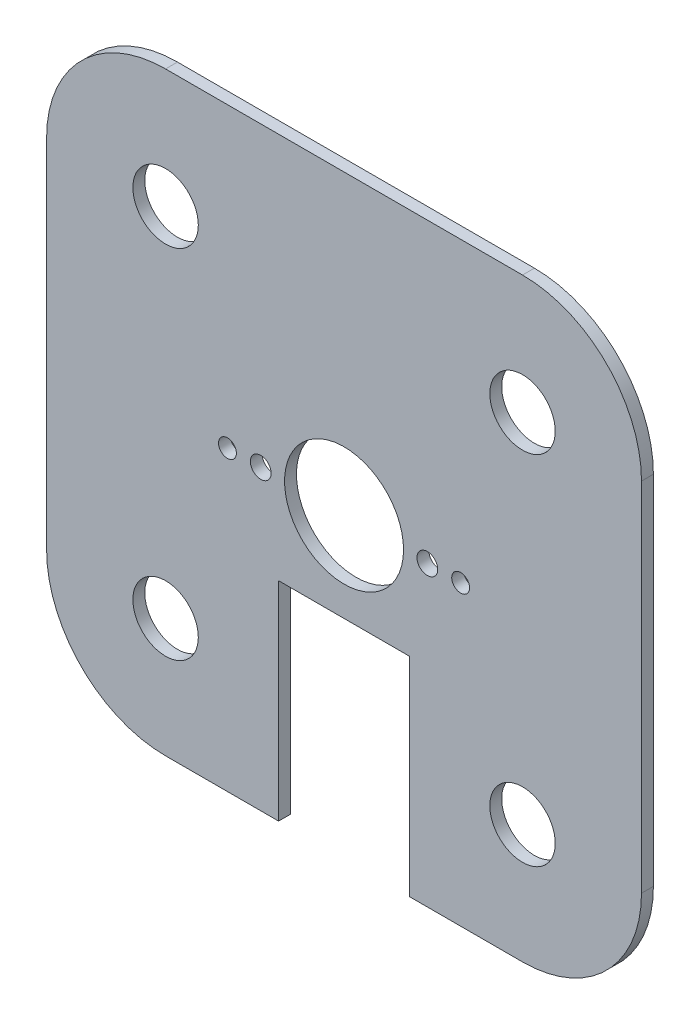
from build123d import *

# Parameters (mm, degrees)
SKETCH1_R           = 2.75
SKETCH1_R_2         = 5
SKETCH1_R_3         = 0.75
SKETCH1_R_4         = 0.875
BOSS_EXTRUDE1_DEPTH = 1
FILLET1_R           = 10
FILLET2_R           = 10
FILLET3_R           = 10
FILLET4_R           = 10


with BuildPart() as part:
    # Sketch1 → Boss-Extrude1 (new body)
    with BuildSketch(Plane.XY):
        Polygon((-25, 25), (-25, -25), (-5.5, -25), (-5.5, -7.5), (5.5, -7.5), (5.5, -25), (25, -25), (25, 25), align=None)
        with Locations((-15, -15)):
            Circle(SKETCH1_R, mode=Mode.SUBTRACT)
        Circle(SKETCH1_R_2, mode=Mode.SUBTRACT)
        with Locations((15, -15)):
            Circle(SKETCH1_R, mode=Mode.SUBTRACT)
        with Locations((-9.8, 0)):
            Circle(SKETCH1_R_3, mode=Mode.SUBTRACT)
        with Locations((-7, 0)):
            Circle(SKETCH1_R_4, mode=Mode.SUBTRACT)
        with Locations((-15, 15)):
            Circle(SKETCH1_R, mode=Mode.SUBTRACT)
        with Locations((7, 0)):
            Circle(SKETCH1_R_4, mode=Mode.SUBTRACT)
        with Locations((9.8, 0)):
            Circle(SKETCH1_R_3, mode=Mode.SUBTRACT)
        with Locations((15, 15)):
            Circle(SKETCH1_R, mode=Mode.SUBTRACT)
    extrude(amount=BOSS_EXTRUDE1_DEPTH)

    # Fillet1
    fillet1_edges = [part.edges().sort_by_distance(p)[0] for p in [
        (-25, -25, 0.5),
    ]]
    fillet(fillet1_edges, radius=FILLET1_R)

    # Fillet2
    fillet2_edges = [part.edges().sort_by_distance(p)[0] for p in [
        (-25, 25, 0.5),
    ]]
    fillet(fillet2_edges, radius=FILLET2_R)

    # Fillet3
    fillet3_edges = [part.edges().sort_by_distance(p)[0] for p in [
        (25, -25, 0.5),
    ]]
    fillet(fillet3_edges, radius=FILLET3_R)

    # Fillet4
    fillet4_edges = [part.edges().sort_by_distance(p)[0] for p in [
        (25, 25, 0.5),
    ]]
    fillet(fillet4_edges, radius=FILLET4_R)


solid = part.part
